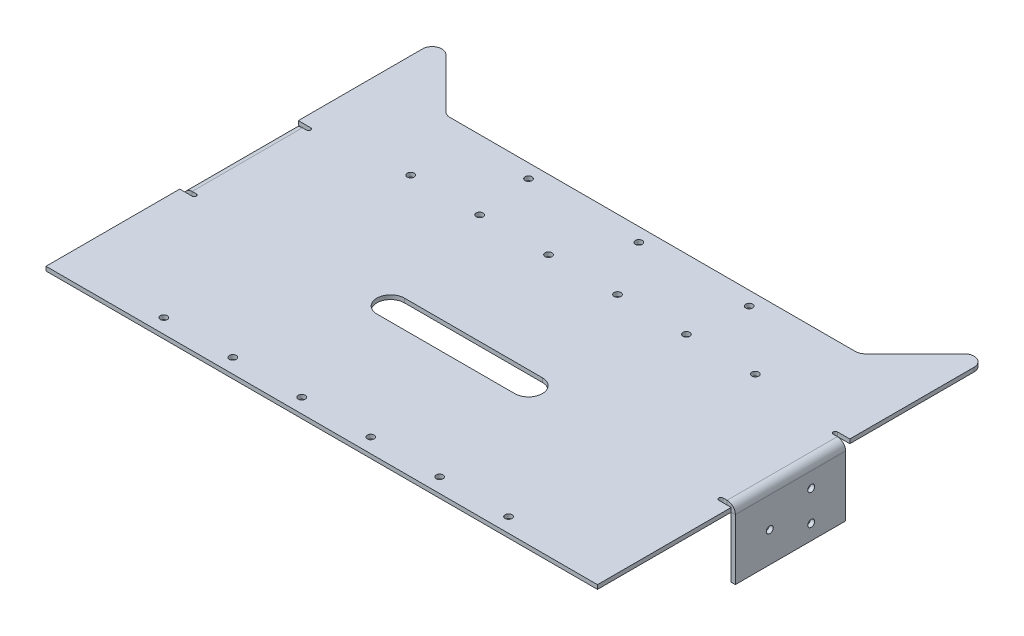
from build123d import *

# Parameters (mm, degrees)
SKETCH1_W                = 400
SKETCH1_H                = 3
BASE_FLANGE1_DEPTH       = 290
CUT_EXTRUDE1_REACH       = 354.291
EDGE_FLANGE1_START       = -6
EDGE_FLANGE1_DEPTH       = 7
EDGE_FLANGE1_START_2     = -0.31686
EDGE_FLANGE1_2_OUTLINE_W = 3
EDGE_FLANGE1_2_OUTLINE_H = 80
EDGE_FLANGE1_2_DEPTH     = 1.31686
EDGE_FLANGE1_START_3     = -50
EDGE_FLANGE1_3_OUTLINE_W = 3
EDGE_FLANGE1_3_OUTLINE_H = 80
EDGE_FLANGE1_3_DEPTH     = 44
EDGE_FLANGE1_START_4     = 110
EDGE_FLANGE1_4_DEPTH     = 80
EDGE_FLANGE1_5_DEPTH     = 80
SKETCH15_R               = 2.5
CUT_EXTRUDE2_DEPTH       = 497.588360717
FILLET1_R                = 7
SKETCH16_R               = 2.5
CUT_EXTRUDE3_DEPTH       = 10
CUT_EXTRUDE4_REACH       = 357.4
SKETCH17_R               = 2.5
CUT_EXTRUDE5_REACH       = 357.809


with BuildPart() as part:
    # Base-Flange1: sheet metal written as solids
    # Sketch1 → Base-Flange1 (new body)
    with BuildSketch(Plane.XY):
        with Locations((0, -1.5)):
            Rectangle(SKETCH1_W, SKETCH1_H)
    extrude(amount=BASE_FLANGE1_DEPTH)

    # Sketch6 → Cut-Extrude1 (cut, up to next)
    with BuildSketch(Plane.XZ.offset(3), mode=Mode.PRIVATE) as cut_extrude1_sk1:
        Polygon((200, 0), (150, 50), (-150, 50), (-200, 0), align=None)
    cut_extrude1_tool1 = extrude(cut_extrude1_sk1.sketch, amount=-CUT_EXTRUDE1_REACH, mode=Mode.PRIVATE) & part.part
    add(cut_extrude1_tool1.solids().sort_by_distance((0, -3, 23.809524))[0], mode=Mode.SUBTRACT)

    # Edge-Flange1: read off the stored shape, not the designer's step
    # Edge-Flange1 outline → Edge-Flange1 (cut)
    with BuildSketch(Plane(origin=(0, 0, 0), x_dir=(1, 0, 0), z_dir=(0, 1, 0)).offset(EDGE_FLANGE1_START)):
        with BuildLine():
            Line((200, -193), (200, -190))
            Line((200, -190), (191, -190))
            ThreePointArc((191, -190), (189.5, -191.5), (191, -193))
            Line((191, -193), (200, -193))
        make_face()
        with BuildLine():
            Line((191, -110), (200, -110))
            Line((200, -110), (200, -107))
            Line((200, -107), (191, -107))
            ThreePointArc((191, -107), (189.5, -108.5), (191, -110))
        make_face()
        with BuildLine():
            Line((-200, -107), (-200, -110))
            Line((-200, -110), (-191, -110))
            ThreePointArc((-191, -110), (-189.5, -108.5), (-191, -107))
            Line((-191, -107), (-200, -107))
        make_face()
        with BuildLine():
            Line((-191, -190), (-200, -190))
            Line((-200, -190), (-200, -193))
            Line((-200, -193), (-191, -193))
            ThreePointArc((-191, -193), (-189.5, -191.5), (-191, -190))
        make_face()
    extrude(amount=EDGE_FLANGE1_DEPTH, mode=Mode.SUBTRACT)

    # Edge-Flange1 2 outline → Edge-Flange1 2 (cut)
    with BuildSketch(Plane(origin=(0, 0, 0), x_dir=(1, 0, 0), z_dir=(0, 1, 0)).offset(EDGE_FLANGE1_START_2)):
        with Locations((198.5, -150)):
            Rectangle(EDGE_FLANGE1_2_OUTLINE_W, EDGE_FLANGE1_2_OUTLINE_H)
        with Locations((-198.5, -150)):
            Rectangle(EDGE_FLANGE1_2_OUTLINE_W, EDGE_FLANGE1_2_OUTLINE_H)
    extrude(amount=EDGE_FLANGE1_2_DEPTH, mode=Mode.SUBTRACT)

    # Edge-Flange1 4 outline → Edge-Flange1 4 (cut)
    with BuildSketch(Plane.XY.offset(EDGE_FLANGE1_START_4)):
        with BuildLine():
            Line((-200, -3), (-199.196152423, -3))
            ThreePointArc((-199.196152423, -3), (-197, -0.803847577), (-194, 0))
            Line((-194, 0), (-197, 0))
            Line((-197, 0), (-197, -0.31686))
            Line((-197, -0.31686), (-200, -0.31686))
            Line((-200, -0.31686), (-200, -3))
        make_face()
        with BuildLine():
            Line((197, 0), (194, 0))
            ThreePointArc((194, 0), (197, -0.803847577), (199.196152423, -3))
            Line((199.196152423, -3), (200, -3))
            Line((200, -3), (200, -0.31686))
            Line((200, -0.31686), (197, -0.31686))
            Line((197, -0.31686), (197, 0))
        make_face()
    extrude(amount=EDGE_FLANGE1_4_DEPTH, mode=Mode.SUBTRACT)



with BuildPart() as body_2:
    # Edge-Flange1 3 outline → Edge-Flange1 3 (new body)
    with BuildSketch(Plane(origin=(0, 0, 0), x_dir=(1, 0, 0), z_dir=(0, 1, 0)).offset(EDGE_FLANGE1_START_3)):
        with Locations((198.5, -150)):
            Rectangle(EDGE_FLANGE1_3_OUTLINE_W, EDGE_FLANGE1_3_OUTLINE_H)
        with Locations((-198.5, -150)):
            Rectangle(EDGE_FLANGE1_3_OUTLINE_W, EDGE_FLANGE1_3_OUTLINE_H)
    extrude(amount=EDGE_FLANGE1_3_DEPTH)


with BuildPart() as part_1:
    add(part.part)

    add(body_2.part)  # Edge-Flange1 5 merges body 2
    # Edge-Flange1 5 outline → Edge-Flange1 5 (add)
    with BuildSketch(Plane.XY.offset(EDGE_FLANGE1_START_4)):
        with BuildLine():
            ThreePointArc((-199.196152423, -3), (-199.795554958, -4.447085729), (-200, -6))
            Line((-200, -6), (-197, -6))
            ThreePointArc((-197, -6), (-196.121320344, -3.878679656), (-194, -3))
            Line((-194, -3), (-199.196152423, -3))
        make_face()
        with BuildLine():
            Line((199.196152423, -3), (194, -3))
            ThreePointArc((194, -3), (196.121320344, -3.878679656), (197, -6))
            Line((197, -6), (200, -6))
            ThreePointArc((200, -6), (199.795554958, -4.447085729), (199.196152423, -3))
        make_face()
    extrude(amount=EDGE_FLANGE1_5_DEPTH)

    # Sketch15 → Cut-Extrude2 (cut, through all)
    with BuildSketch(Plane(origin=(200, 0, 0), x_dir=(0, 0, -1), z_dir=(1, 0, 0))):
        with Locations(Location((-165, -28, 0), (0, 0, 90))):
            Circle(SKETCH15_R)
        with Locations(Location((-135, -17, 0), (0, 0, 90))):
            Circle(SKETCH15_R)
        with Locations(Location((-135, -39, 0), (0, 0, 90))):
            Circle(SKETCH15_R)
    extrude(amount=-CUT_EXTRUDE2_DEPTH, mode=Mode.SUBTRACT)

    # Fillet1
    fillet1_edges = [part_1.edges().sort_by_distance(p)[0] for p in [
        (-150, -1.5, 50),
        (150, -1.5, 50),
        (-200, -1.5, 0),
        (200, -1.5, 0),
    ]]
    fillet(fillet1_edges, radius=FILLET1_R)

    # Sketch16 → Cut-Extrude3 (cut)
    with BuildSketch(Plane(origin=(0, 0, 0), x_dir=(1, 0, 0), z_dir=(0, 1, 0))):
        with Locations(Location((0, -60, 0), (0, 0, 270))):
            Circle(SKETCH16_R)
        with Locations(Location((80, -60, 0), (0, 0, 270))):
            Circle(SKETCH16_R)
        with Locations(Location((-80, -60, 0), (0, 0, 90))):
            Circle(SKETCH16_R)
    extrude(amount=-CUT_EXTRUDE3_DEPTH, mode=Mode.SUBTRACT)

    # Sketch17 → Cut-Extrude4 (cut, up to next)
    with BuildSketch(Plane.XZ.offset(3), mode=Mode.PRIVATE) as cut_extrude4_sk1:
        with Locations(Location((-125, 279.5, 0), (0, 0, 270))):
            Circle(SKETCH17_R)
    cut_extrude4_tool1 = extrude(cut_extrude4_sk1.sketch, amount=-CUT_EXTRUDE4_REACH, mode=Mode.PRIVATE) & part_1.part
    # Sketch17 → Cut-Extrude4 (cut, up to next)
    with BuildSketch(Plane.XZ.offset(3), mode=Mode.PRIVATE) as cut_extrude4_sk2:
        with Locations(Location((-125, 100.5, 0), (0, 0, 270))):
            Circle(SKETCH17_R)
    cut_extrude4_tool2 = extrude(cut_extrude4_sk2.sketch, amount=-CUT_EXTRUDE4_REACH, mode=Mode.PRIVATE) & part_1.part
    # Sketch17 → Cut-Extrude4 (cut, up to next)
    with BuildSketch(Plane.XZ.offset(3), mode=Mode.PRIVATE) as cut_extrude4_sk3:
        with Locations(Location((-75, 279.5, 0), (0, 0, 270))):
            Circle(SKETCH17_R)
    cut_extrude4_tool3 = extrude(cut_extrude4_sk3.sketch, amount=-CUT_EXTRUDE4_REACH, mode=Mode.PRIVATE) & part_1.part
    # Sketch17 → Cut-Extrude4 (cut, up to next)
    with BuildSketch(Plane.XZ.offset(3), mode=Mode.PRIVATE) as cut_extrude4_sk4:
        with Locations(Location((-75, 100.5, 0), (0, 0, 270))):
            Circle(SKETCH17_R)
    cut_extrude4_tool4 = extrude(cut_extrude4_sk4.sketch, amount=-CUT_EXTRUDE4_REACH, mode=Mode.PRIVATE) & part_1.part
    # Sketch17 → Cut-Extrude4 (cut, up to next)
    with BuildSketch(Plane.XZ.offset(3), mode=Mode.PRIVATE) as cut_extrude4_sk5:
        with Locations(Location((-25, 279.5, 0), (0, 0, 270))):
            Circle(SKETCH17_R)
    cut_extrude4_tool5 = extrude(cut_extrude4_sk5.sketch, amount=-CUT_EXTRUDE4_REACH, mode=Mode.PRIVATE) & part_1.part
    # Sketch17 → Cut-Extrude4 (cut, up to next)
    with BuildSketch(Plane.XZ.offset(3), mode=Mode.PRIVATE) as cut_extrude4_sk6:
        with Locations(Location((-25, 100.5, 0), (0, 0, 270))):
            Circle(SKETCH17_R)
    cut_extrude4_tool6 = extrude(cut_extrude4_sk6.sketch, amount=-CUT_EXTRUDE4_REACH, mode=Mode.PRIVATE) & part_1.part
    # Sketch17 → Cut-Extrude4 (cut, up to next)
    with BuildSketch(Plane.XZ.offset(3), mode=Mode.PRIVATE) as cut_extrude4_sk7:
        with Locations(Location((25, 279.5, 0), (0, 0, 270))):
            Circle(SKETCH17_R)
    cut_extrude4_tool7 = extrude(cut_extrude4_sk7.sketch, amount=-CUT_EXTRUDE4_REACH, mode=Mode.PRIVATE) & part_1.part
    # Sketch17 → Cut-Extrude4 (cut, up to next)
    with BuildSketch(Plane.XZ.offset(3), mode=Mode.PRIVATE) as cut_extrude4_sk8:
        with Locations(Location((25, 100.5, 0), (0, 0, 270))):
            Circle(SKETCH17_R)
    cut_extrude4_tool8 = extrude(cut_extrude4_sk8.sketch, amount=-CUT_EXTRUDE4_REACH, mode=Mode.PRIVATE) & part_1.part
    # Sketch17 → Cut-Extrude4 (cut, up to next)
    with BuildSketch(Plane.XZ.offset(3), mode=Mode.PRIVATE) as cut_extrude4_sk9:
        with Locations(Location((75, 279.5, 0), (0, 0, 270))):
            Circle(SKETCH17_R)
    cut_extrude4_tool9 = extrude(cut_extrude4_sk9.sketch, amount=-CUT_EXTRUDE4_REACH, mode=Mode.PRIVATE) & part_1.part
    # Sketch17 → Cut-Extrude4 (cut, up to next)
    with BuildSketch(Plane.XZ.offset(3), mode=Mode.PRIVATE) as cut_extrude4_sk10:
        with Locations(Location((75, 100.5, 0), (0, 0, 270))):
            Circle(SKETCH17_R)
    cut_extrude4_tool10 = extrude(cut_extrude4_sk10.sketch, amount=-CUT_EXTRUDE4_REACH, mode=Mode.PRIVATE) & part_1.part
    # Sketch17 → Cut-Extrude4 (cut, up to next)
    with BuildSketch(Plane.XZ.offset(3), mode=Mode.PRIVATE) as cut_extrude4_sk11:
        with Locations(Location((125, 279.5, 0), (0, 0, 270))):
            Circle(SKETCH17_R)
    cut_extrude4_tool11 = extrude(cut_extrude4_sk11.sketch, amount=-CUT_EXTRUDE4_REACH, mode=Mode.PRIVATE) & part_1.part
    # Sketch17 → Cut-Extrude4 (cut, up to next)
    with BuildSketch(Plane.XZ.offset(3), mode=Mode.PRIVATE) as cut_extrude4_sk12:
        with Locations(Location((125, 100.5, 0), (0, 0, 270))):
            Circle(SKETCH17_R)
    cut_extrude4_tool12 = extrude(cut_extrude4_sk12.sketch, amount=-CUT_EXTRUDE4_REACH, mode=Mode.PRIVATE) & part_1.part
    add(cut_extrude4_tool1.solids().sort_by_distance((-125, -3, 279.5))[0], mode=Mode.SUBTRACT)
    add(cut_extrude4_tool2.solids().sort_by_distance((-125, -3, 100.5))[0], mode=Mode.SUBTRACT)
    add(cut_extrude4_tool3.solids().sort_by_distance((-75, -3, 279.5))[0], mode=Mode.SUBTRACT)
    add(cut_extrude4_tool4.solids().sort_by_distance((-75, -3, 100.5))[0], mode=Mode.SUBTRACT)
    add(cut_extrude4_tool5.solids().sort_by_distance((-25, -3, 279.5))[0], mode=Mode.SUBTRACT)
    add(cut_extrude4_tool6.solids().sort_by_distance((-25, -3, 100.5))[0], mode=Mode.SUBTRACT)
    add(cut_extrude4_tool7.solids().sort_by_distance((25, -3, 279.5))[0], mode=Mode.SUBTRACT)
    add(cut_extrude4_tool8.solids().sort_by_distance((25, -3, 100.5))[0], mode=Mode.SUBTRACT)
    add(cut_extrude4_tool9.solids().sort_by_distance((75, -3, 279.5))[0], mode=Mode.SUBTRACT)
    add(cut_extrude4_tool10.solids().sort_by_distance((75, -3, 100.5))[0], mode=Mode.SUBTRACT)
    add(cut_extrude4_tool11.solids().sort_by_distance((125, -3, 279.5))[0], mode=Mode.SUBTRACT)
    add(cut_extrude4_tool12.solids().sort_by_distance((125, -3, 100.5))[0], mode=Mode.SUBTRACT)

    # Sketch18 → Cut-Extrude5 (cut, up to next)
    with BuildSketch(Plane(origin=(0, 0, 0), x_dir=(1, 0, 0), z_dir=(0, 1, 0)), mode=Mode.PRIVATE) as cut_extrude5_sk1:
        with BuildLine():
            Line((50, -200), (-50, -200))
            ThreePointArc((-50, -200), (-60, -190), (-50, -180))
            Line((-50, -180), (50, -180))
            ThreePointArc((50, -180), (60, -190), (50, -200))
        make_face()
    cut_extrude5_tool1 = extrude(cut_extrude5_sk1.sketch, amount=-CUT_EXTRUDE5_REACH, mode=Mode.PRIVATE) & part_1.part
    add(cut_extrude5_tool1.solids().sort_by_distance((0, 0, 190))[0], mode=Mode.SUBTRACT)


solid = part_1.part
